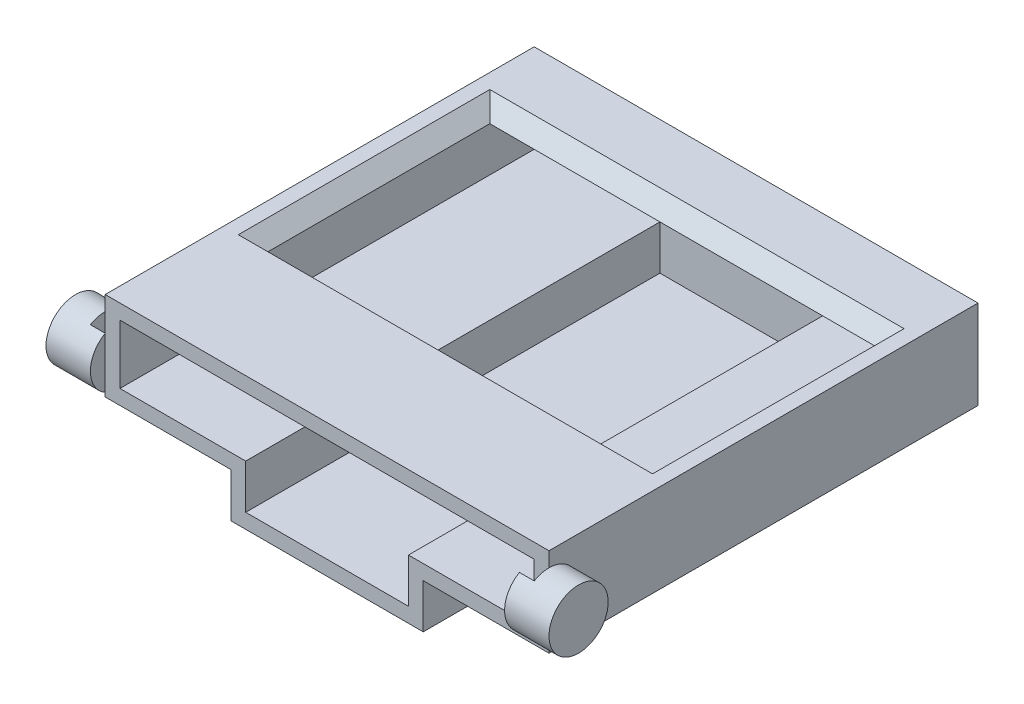
from build123d import *

# Parameters (mm, degrees)
ESQUISSE1_W             = 30
ESQUISSE1_H             = 29
BOSS_EXTRU_1_DEPTH      = 6
COQUE1_T                = -1
ENL_V_MAT_EXTRU_1_REACH = 44.154
ESQUISSE2_W             = 26
ESQUISSE2_H             = 15
ESQUISSE3_W             = 13
ESQUISSE3_H             = 29
BOSS_EXTRU_2_DEPTH      = 3
ESQUISSE5_W             = 11
ESQUISSE5_H             = 28
ENL_V_MAT_EXTRU_2_DEPTH = 3
BOSS_EXTRU_3_DEPTH      = 2
BOSS_EXTRU_3_DEPTH_BACK = 1
ESQUISSE6_R             = 2
BOSS_EXTRU_4_DEPTH      = 2
BOSS_EXTRU_4_DEPTH_BACK = 1
ESQUISSE7_R             = 2
CHANFREIN1_SIZE         = 1
ESQUISSE11_W            = 1
ESQUISSE11_H            = 5.866928615
ENL_V_MAT_EXTRU_5_DEPTH = 1
ESQUISSE12_W            = 1
ESQUISSE12_H            = 9.243044447
ENL_V_MAT_EXTRU_6_DEPTH = 1


with BuildPart() as part:
    # Esquisse1 → Boss.-Extru.1 (new body)
    with BuildSketch(Plane(origin=(0, 0, 0), x_dir=(1, 0, 0), z_dir=(0, 1, 0))):
        with Locations((15, 14.5)):
            Rectangle(ESQUISSE1_W, ESQUISSE1_H)
    extrude(amount=BOSS_EXTRU_1_DEPTH)

    # Coque1
    coque1_openings = [part.faces().sort_by_distance(p)[0] for p in [
        (15, 3, 0),
    ]]
    offset(amount=COQUE1_T, openings=coque1_openings, kind=Kind.INTERSECTION)

    # Esquisse2 → Enlèv. mat.-Extru.1 (cut, up to next)
    with BuildSketch(Plane(origin=(0, 6, 0), x_dir=(1, 0, 0), z_dir=(0, 1, 0)), mode=Mode.PRIVATE) as enl_v_mat_extru_1_sk1:
        with Locations((15, 16.5)):
            Rectangle(ESQUISSE2_W, ESQUISSE2_H)
    enl_v_mat_extru_1_tool1 = extrude(enl_v_mat_extru_1_sk1.sketch, amount=-ENL_V_MAT_EXTRU_1_REACH, mode=Mode.PRIVATE) & part.part
    add(enl_v_mat_extru_1_tool1.solids().sort_by_distance((15, 6, -16.5))[0], mode=Mode.SUBTRACT)

    # Esquisse3 → Boss.-Extru.2 (add)
    with BuildSketch(Plane.XZ):
        with Locations((15, -14.5)):
            Rectangle(ESQUISSE3_W, ESQUISSE3_H)
    extrude(amount=BOSS_EXTRU_2_DEPTH)

    # Esquisse5 → Enlèv. mat.-Extru.2 (cut)
    with BuildSketch(Plane(origin=(0, 1, 0), x_dir=(1, 0, 0), z_dir=(0, 1, 0))):
        with Locations((15, 14)):
            Rectangle(ESQUISSE5_W, ESQUISSE5_H)
    extrude(amount=-ENL_V_MAT_EXTRU_2_DEPTH, mode=Mode.SUBTRACT)

    # Esquisse6 → Boss.-Extru.3 (add, two sides: drawn at the far end of the back side and taken through both)
    with BuildSketch(Plane(origin=(30, 0, 0), x_dir=(0, 0, -1), z_dir=(1, 0, 0)).offset(-BOSS_EXTRU_3_DEPTH_BACK)):
        with Locations((0, 3)):
            Circle(ESQUISSE6_R)
    extrude(amount=BOSS_EXTRU_3_DEPTH + BOSS_EXTRU_3_DEPTH_BACK)

    # Esquisse7 → Boss.-Extru.4 (add, two sides: drawn at the far end of the back side and taken through both)
    with BuildSketch(Plane.ZY.offset(-BOSS_EXTRU_4_DEPTH_BACK)):
        with Locations(Location((0, 3, 0), (0, 0, 180))):
            Circle(ESQUISSE7_R)
    extrude(amount=BOSS_EXTRU_4_DEPTH + BOSS_EXTRU_4_DEPTH_BACK)

    # Chanfrein1
    chanfrein1_edges = [part.edges().sort_by_distance(p)[0] for p in [
        (15, 6, -24),
        (28, 6, -16.5),
        (15, 6, -9),
        (2, 6, -16.5),
    ]]
    chamfer(chanfrein1_edges, length=CHANFREIN1_SIZE - 0.0001)  # a hair under: the kernel refuses the full size

    # Esquisse11 → Enlèv. mat.-Extru.5 (cut)
    with BuildSketch(Plane.ZY.offset(-29)):
        with Locations((0.5, 3.436697282)):
            Rectangle(ESQUISSE11_W, ESQUISSE11_H)
    extrude(amount=-ENL_V_MAT_EXTRU_5_DEPTH, mode=Mode.SUBTRACT)

    # Esquisse12 → Enlèv. mat.-Extru.6 (cut)
    with BuildSketch(Plane(origin=(1, 0, 0), x_dir=(0, 0, -1), z_dir=(1, 0, 0))):
        with Locations((-0.5, 2.795315934)):
            Rectangle(ESQUISSE12_W, ESQUISSE12_H)
    extrude(amount=-ENL_V_MAT_EXTRU_6_DEPTH, mode=Mode.SUBTRACT)


solid = part.part
